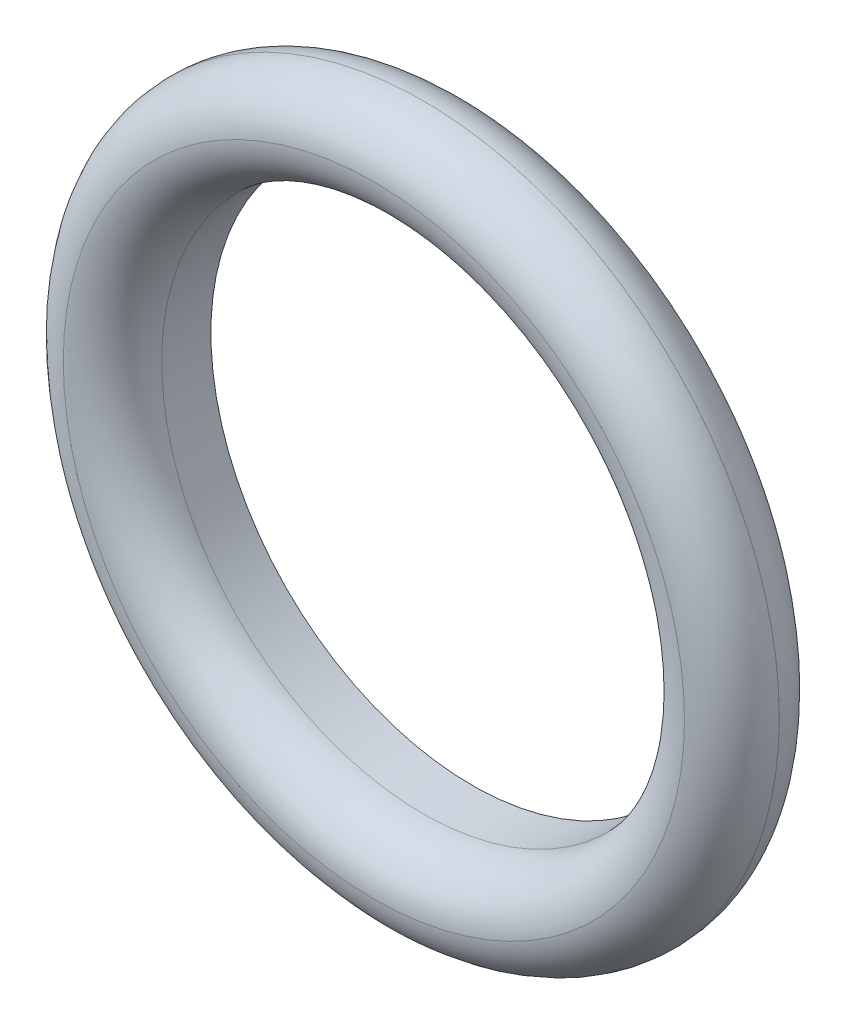
from build123d import *

# Parameters (mm, degrees)
SKETCH1_R           = 72.401096357
SKETCH1_R_2         = 53.117079775
BOSS_EXTRUDE1_DEPTH = 20
FILLET8_R           = 10
FILLET9_R           = 10
FILLET10_R          = 10


with BuildPart() as part:
    # Sketch1 → Boss-Extrude1 (new body)
    with BuildSketch(Plane.XY):
        Circle(SKETCH1_R)
        Circle(SKETCH1_R_2, mode=Mode.SUBTRACT)
    extrude(amount=BOSS_EXTRUDE1_DEPTH)

    # Fillet8
    fillet8_edges = [part.edges().sort_by_distance(p)[0] for p in [
        (-53.117079775, 0, 20),
    ]]
    fillet(fillet8_edges, radius=FILLET8_R)

    # Fillet9
    # the kernel refuses this fillet: 10 mm, written as the material it takes off along each edge
    with BuildSketch(Plane(origin=(0, 0, 20), x_dir=(1, 0, 0), z_dir=(0, -1, 0))) as fillet9_piece_1:
        with BuildLine():
            CenterArc((62.401096357, -9.974335454), FILLET9_R, 0, 85.894204151)
            Line((72.401096357, -9.974335454), (72.601096357, -9.974335454))
            Line((72.601096357, -9.974335454), (72.601096357, 0))
            Line((72.601096357, 0), (72.401096357, 0.2))
            ThreePointArc((72.401096357, 0.2), (67.759088066, 0.2), (63.131399443, 0.199486709))
            Line((63.131399443, 0.199486709), (63.117079775, 0))
        make_face()
    revolve(axis=Axis((0, 0, 20), (0, 0, 1)), mode=Mode.SUBTRACT)

    # Fillet10
    fillet10_edges = [part.edges().sort_by_distance(p)[0] for p in [
        (-72.401096357, 0, 0),
    ]]
    fillet(fillet10_edges, radius=FILLET10_R)


solid = part.part
